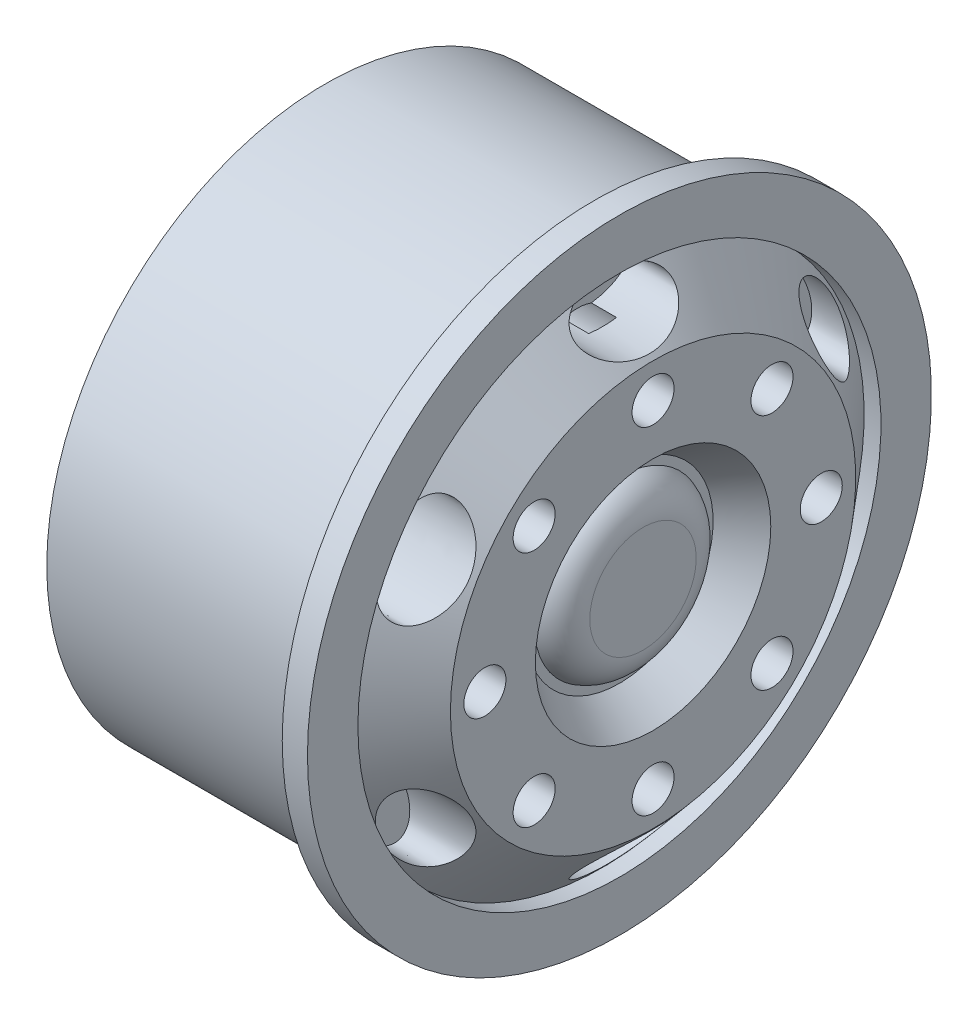
from build123d import *

# Parameters (mm, degrees)
SKETCH2_R          = 1.25
CUT_EXTRUDE1_DEPTH = 33.687229922
SKETCH3_R          = 2.5
CUT_EXTRUDE2_DEPTH = 16.5
SKETCH7_R          = 4.725
CUT_EXTRUDE7_DEPTH = 10
FILLET1_R          = 2
SKETCH8_RX         = 3
SKETCH8_RY         = 1.5
CUT_EXTRUDE8_DEPTH = 2.5
SKETCH4_R          = 1.25
CUT_EXTRUDE5_DEPTH = 5


with BuildPart() as part:
    # Sketch1 → Revolve1 (revolve)
    with BuildSketch(Plane(origin=(0, 0, 0), x_dir=(1, 0, 0), z_dir=(0, 1, 0)), mode=Mode.PRIVATE) as revolve1_sk:
        Polygon((12.139813159, 7), (12.139813159, 12.05), (9.139813159, 15.55), (10.139813159, 15.55), (10.139813159, 16.55), (10.139813159, 18.55), (8.639813159, 18.55), (8.639813159, 16.55), (-7.360186841, 16.55), (-7.360186841, 14.55), (-7.360186841, 0), (11.541615212, 0), (11.541615212, 5.071775549), (10.139813159, 5.071775549), (10.139813159, 5.571775549), align=None)
    revolve(revolve1_sk.sketch.rotate(Axis((-37.278866169, 0, 0), (1, 0, 0)), 180), axis=Axis((-37.278866169, 0, 0), (1, 0, 0)))

    # Sketch2 → Cut-Extrude1 (cut, through all)
    with BuildSketch(Plane(origin=(12.139813159, 0, 0), x_dir=(0, 0, -1), z_dir=(1, 0, 0))):
        with Locations((0, 10)):
            Circle(SKETCH2_R)
        with Locations((7.071067812, 7.071067812)):
            Circle(SKETCH2_R)
        with Locations((10, 0)):
            Circle(SKETCH2_R)
        with Locations((7.071067812, -7.071067812)):
            Circle(SKETCH2_R)
        with Locations((0, -10)):
            Circle(SKETCH2_R)
        with Locations((-7.071067812, -7.071067812)):
            Circle(SKETCH2_R)
        with Locations((-10, 0)):
            Circle(SKETCH2_R)
        with Locations((-7.071067812, 7.071067812)):
            Circle(SKETCH2_R)
    extrude(amount=-CUT_EXTRUDE1_DEPTH, mode=Mode.SUBTRACT)

    # Sketch3 → Cut-Extrude2 (cut)
    with BuildSketch(Plane.ZY.offset(7.360186841)):
        with Locations((0, 10)):
            Circle(SKETCH3_R)
        with Locations((7.071067812, 7.071067812)):
            Circle(SKETCH3_R)
        with Locations((10, 0)):
            Circle(SKETCH3_R)
        with Locations((7.071067812, -7.071067812)):
            Circle(SKETCH3_R)
        with Locations((0, -10)):
            Circle(SKETCH3_R)
        with Locations((-7.071067812, -7.071067812)):
            Circle(SKETCH3_R)
        with Locations((-10, 0)):
            Circle(SKETCH3_R)
        with Locations((-7.071067812, 7.071067812)):
            Circle(SKETCH3_R)
    extrude(amount=-CUT_EXTRUDE2_DEPTH, mode=Mode.SUBTRACT)

    # Sketch7 → Cut-Extrude7 (cut)
    with BuildSketch(Plane.ZY.offset(7.360186841)):
        Circle(SKETCH7_R)
    extrude(amount=-CUT_EXTRUDE7_DEPTH, mode=Mode.SUBTRACT)

    # Fillet1
    # the kernel refuses this fillet: 2 mm, written as the material it takes off along each edge
    with BuildSketch(Plane(origin=(11.541615212, 0, 0), x_dir=(0, 0, 1), z_dir=(0, 1, 0))) as fillet1_piece_1:
        with BuildLine():
            CenterArc((3.163331362, -2), FILLET1_R, 17.403493434, 72.596506566)
            Line((3.163331362, 0), (3.163331362, 0.04))
            Line((3.163331362, 0.04), (5.071775549, 0.04))
            Line((5.071775549, 0.04), (5.111775549, 0))
            ThreePointArc((5.111775549, 0), (5.111775549, -0.700901026), (5.109944433, -1.389838094))
            Line((5.109944433, -1.389838094), (5.071775549, -1.401802053))
        make_face()
    revolve(axis=Axis((11.541615212, 0, 0), (1, 0, 0)), mode=Mode.SUBTRACT)

    # Sketch8 → Cut-Extrude8 (cut, symmetric)
    with BuildSketch(Plane(origin=(10.139813159, 0, 0), x_dir=(0, 0, -1), z_dir=(1, 0, 0))):
        with Locations((0, 13.8)):
            Ellipse(SKETCH8_RX, SKETCH8_RY)
        with Locations(Location((11.951150572, 6.9), (0, 0, 120))):
            Ellipse(SKETCH8_RX, SKETCH8_RY)
        with Locations(Location((11.951150572, -6.9), (0, 0, -120))):
            Ellipse(SKETCH8_RX, SKETCH8_RY)
        with Locations(Location((0, -13.8), (0, 0, 180))):
            Ellipse(SKETCH8_RX, SKETCH8_RY)
        with Locations(Location((-11.951150572, -6.9), (0, 0, 120))):
            Ellipse(SKETCH8_RX, SKETCH8_RY)
        with Locations(Location((-11.951150572, 6.9), (0, 0, -120))):
            Ellipse(SKETCH8_RX, SKETCH8_RY)
    extrude(amount=CUT_EXTRUDE8_DEPTH, both=True, mode=Mode.SUBTRACT)

    # Sketch4 → Cut-Extrude5 (cut)
    with BuildSketch(Plane(origin=(13.139813159, 0, 0), x_dir=(0, 0, -1), z_dir=(1, 0, 0))):
        with Locations((0, 13.75)):
            Circle(SKETCH4_R)
    extrude(amount=-CUT_EXTRUDE5_DEPTH, mode=Mode.SUBTRACT)


solid = part.part
